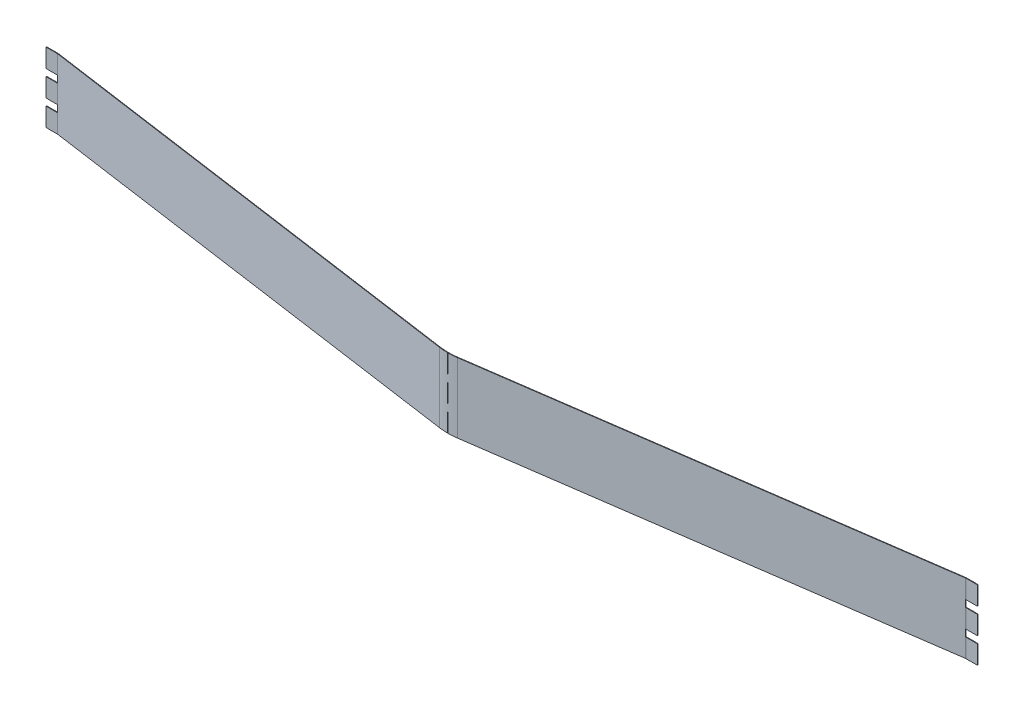
from build123d import *

# Parameters (mm, degrees)
BASE_FLANGE1_DEPTH  = 50
UNFOLD1_START       = -50
UNFOLD1_DEPTH       = 50
UNFOLD1_2_OUTLINE_W = 3.874357202
UNFOLD1_2_OUTLINE_H = 0.25
UNFOLD1_2_DEPTH     = 50
CUT_EXTRUDE2_DEPTH  = 211.401854511
SKETCH6_W           = 5.069534468
SKETCH6_H           = 3
CUT_EXTRUDE3_DEPTH  = 211.401854511
LPATTERN2_COUNT     = 2
LPATTERN2_PITCH     = 11
SKETCH8_W           = 0.3
SKETCH8_H           = 8
CUT_EXTRUDE4_DEPTH  = 211.401854511
LPATTERN3_COUNT     = 5
LPATTERN3_PITCH     = 11
SKETCH9_W           = 404.874357202
SKETCH9_H           = 46.767764052
CUT_EXTRUDE5_DEPTH  = 211.398245103
FOLD1_START         = -30
FOLD1_OUTLINE_W     = 3.874357202
FOLD1_OUTLINE_H     = 0.25
FOLD1_DEPTH         = 30
FOLD1_START_2       = -22
FOLD1_2_DEPTH       = 3
FOLD1_START_3       = -11
FOLD1_3_DEPTH       = 3
FOLD1_4_DEPTH       = 30
FOLD1_5_DEPTH       = 3
FOLD1_6_DEPTH       = 3
FOLD1_7_DEPTH       = 8
FOLD1_START_4       = -19
FOLD1_8_DEPTH       = 8
FOLD1_START_5       = -8
FOLD1_9_DEPTH       = 8


# Read off the part's stored shape, not the designer's step: Unfold1, Fold1
# Sheet-metal steps are written as plain solids
with BuildPart() as part:
    # Sketch1 → Base-Flange1 (new body)
    with BuildSketch(Plane(origin=(0, 0, 0), x_dir=(1, 0, 0), z_dir=(0, 1, 0))):
        with BuildLine():
            Line((-200.5, 0), (-195.552065744, 0))
            ThreePointArc((-195.552065744, 0), (-195.50012958, -0.001833238), (-195.448451933, -0.007323826))
            Line((-195.448451933, -0.007323826), (-3.868286445, -27.226574518))
            ThreePointArc((-3.868286445, -27.226574518), (0, -27.5), (3.868286445, -27.226574518))
            Line((3.868286445, -27.226574518), (195.448451933, -0.007323826))
            ThreePointArc((195.448451933, -0.007323826), (195.50012958, -0.001833238), (195.552065744, 0))
            Line((195.552065744, 0), (200.5, 0))
            Line((200.5, 0), (200.5, 0.25))
            Line((200.5, 0.25), (195.552065744, 0.25))
            ThreePointArc((195.552065744, 0.25), (195.48250259, 0.247544566), (195.413285693, 0.240190488))
            Line((195.413285692, 0.240190488), (3.833120205, -26.979060204))
            ThreePointArc((3.833120205, -26.979060204), (0, -27.25), (-3.833120205, -26.979060204))
            Line((-3.833120205, -26.979060204), (-195.413285692, 0.240190488))
            ThreePointArc((-195.413285692, 0.240190488), (-195.48250259, 0.247544566), (-195.552065743, 0.25))
            Line((-195.552065744, 0.25), (-200.5, 0.25))
            Line((-200.5, 0.25), (-200.5, 0))
        make_face()
    extrude(amount=-BASE_FLANGE1_DEPTH)

    # Unfold1 outline → Unfold1 (cut)
    with BuildSketch(Plane(origin=(0, 0, 0), x_dir=(1, 0, 0), z_dir=(0, 1, 0)).offset(UNFOLD1_START)):
        with BuildLine():
            Line((195.552065744, 0), (193.722727272, 0))
            Line((193.722727272, 0), (3.833120205, -26.979060204))
            ThreePointArc((3.833120205, -26.979060204), (0, -27.25), (-3.833120205, -26.979060204))
            Line((-3.833120205, -26.979060204), (-193.722727272, 0))
            Line((-193.722727272, 0), (-195.552065744, 0))
            ThreePointArc((-195.552065744, 0), (-195.500129581, -0.001833238), (-195.448451933, -0.007323826))
            Line((-195.448451933, -0.007323826), (-3.868286445, -27.226574518))
            ThreePointArc((-3.868286445, -27.226574518), (0, -27.5), (3.868286445, -27.226574518))
            Line((3.868286445, -27.226574518), (195.448451933, -0.007323826))
            ThreePointArc((195.448451933, -0.007323826), (195.500129581, -0.001833238), (195.552065744, 0))
        make_face()
    extrude(amount=UNFOLD1_DEPTH, mode=Mode.SUBTRACT)

    # Unfold1 2 outline → Unfold1 2 (add)
    with BuildSketch(Plane(origin=(0, 0, 0), x_dir=(1, 0, 0), z_dir=(0, 1, 0)).offset(UNFOLD1_START)):
        with BuildLine():
            ThreePointArc((195.413285692, 0.240190488), (195.48250259, 0.247544566), (195.552065744, 0.25))
            Line((195.552065744, 0.25), (-195.552065744, 0.25))
            ThreePointArc((-195.552065744, 0.25), (-195.48250259, 0.247544566), (-195.413285692, 0.240190488))
            Line((-195.413285692, 0.240190488), (-193.722727272, 0))
            Line((-193.722727272, 0), (193.722727272, 0))
            Line((193.722727272, 0), (195.413285692, 0.240190488))
        make_face()
        with Locations((202.437178601, 0.125)):
            Rectangle(UNFOLD1_2_OUTLINE_W, UNFOLD1_2_OUTLINE_H)
    extrude(amount=UNFOLD1_2_DEPTH)

    # Sketch7 → Cut-Extrude2 (cut, through all)
    with BuildSketch(Plane.XY):
        Polygon((-200.5, -30), (-195.552065744, -30), (1.937178601, -50), (199.304822734, -30), (204.374357202, -30), (227.072555567, -34.066984848), (175.364463115, -76.287353915), (-151.111703925, -76.287353915), (-215.740676819, -64.707357595), align=None)
    extrude(amount=-CUT_EXTRUDE2_DEPTH, mode=Mode.SUBTRACT)

    # Sketch6 → Cut-Extrude3 (cut, through all)
    with BuildSketch(Plane.XY):
        with Locations((-197.965232766, -9.5)):
            Rectangle(SKETCH6_W, SKETCH6_H)
        with Locations((201.839589968, -9.5)):
            Rectangle(SKETCH6_W, SKETCH6_H)
    cut_extrude3 = extrude(amount=-CUT_EXTRUDE3_DEPTH, mode=Mode.SUBTRACT)

    # LPattern2: Cut-Extrude3 ×2
    with Locations(*[(0, -i * LPATTERN2_PITCH, 0) for i in range(1, LPATTERN2_COUNT)]):
        add(cut_extrude3, mode=Mode.SUBTRACT)

    # Sketch8 → Cut-Extrude4 (cut, through all)
    with BuildSketch(Plane.XY):
        with Locations((1.937178601, -4)):
            Rectangle(SKETCH8_W, SKETCH8_H)
    cut_extrude4 = extrude(amount=-CUT_EXTRUDE4_DEPTH, mode=Mode.SUBTRACT)

    # LPattern3: Cut-Extrude4 ×5
    with Locations(*[(0, -i * LPATTERN3_PITCH, 0) for i in range(1, LPATTERN3_COUNT)]):
        add(cut_extrude4, mode=Mode.SUBTRACT)

    # Sketch9 → Cut-Extrude5 (cut, through all)
    with BuildSketch(Plane.XY):
        with Locations((1.937178601, -53.383882026)):
            Rectangle(SKETCH9_W, SKETCH9_H)
    extrude(amount=-CUT_EXTRUDE5_DEPTH, mode=Mode.SUBTRACT)

    # Fold1 outline → Fold1 (cut)
    with BuildSketch(Plane(origin=(0, 0, 0), x_dir=(1, 0, 0), z_dir=(0, 1, 0)).offset(FOLD1_START)):
        with BuildLine():
            Line((193.722727272, 0), (195.413285692, 0.240190488))
            ThreePointArc((195.413285692, 0.240190488), (195.48250259, 0.247544566), (195.552065744, 0.25))
            Line((195.552065744, 0.25), (-195.552065744, 0.25))
            ThreePointArc((-195.552065744, 0.25), (-195.48250259, 0.247544566), (-195.413285692, 0.240190488))
            Line((-195.413285692, 0.240190488), (-193.722727272, 0))
            Line((-193.722727272, 0), (193.722727272, 0))
        make_face()
        with Locations((202.437178601, 0.125)):
            Rectangle(FOLD1_OUTLINE_W, FOLD1_OUTLINE_H)
    extrude(amount=FOLD1_DEPTH, mode=Mode.SUBTRACT)

    # Fold1 2 outline → Fold1 2 (cut)
    with BuildSketch(Plane(origin=(0, 0, 0), x_dir=(1, 0, 0), z_dir=(0, 1, 0)).offset(FOLD1_START_2)):
        with BuildLine():
            ThreePointArc((195.552065744, 0.25), (195.48250259, 0.247544566), (195.413285692, 0.240190488))
            Line((195.413285692, 0.240190488), (195.447411381, 0))
            Line((195.447411381, 0), (199.304822734, 0))
            Line((199.304822734, 0), (199.304822734, 0.25))
            Line((199.304822734, 0.25), (195.552065744, 0.25))
        make_face()
        with BuildLine():
            Line((-195.430465532, 0.119271783), (-195.413285692, 0.240190488))
            ThreePointArc((-195.413285692, 0.240190488), (-195.42187059, 0.241371769), (-195.430465532, 0.242477601))
            Line((-195.430465532, 0.242477601), (-195.430465532, 0.119271783))
        make_face()
    extrude(amount=FOLD1_2_DEPTH, mode=Mode.SUBTRACT)

    # Fold1 3 outline → Fold1 3 (cut)
    with BuildSketch(Plane(origin=(0, 0, 0), x_dir=(1, 0, 0), z_dir=(0, 1, 0)).offset(FOLD1_START_3)):
        with BuildLine():
            ThreePointArc((195.552065744, 0.25), (195.48250259, 0.247544566), (195.413285692, 0.240190488))
            Line((195.413285692, 0.240190488), (195.447411381, 0))
            Line((195.447411381, 0), (199.304822734, 0))
            Line((199.304822734, 0), (199.304822734, 0.25))
            Line((199.304822734, 0.25), (195.552065744, 0.25))
        make_face()
        with BuildLine():
            Line((-195.430465532, 0.119271783), (-195.413285692, 0.240190488))
            ThreePointArc((-195.413285692, 0.240190488), (-195.42187059, 0.241371769), (-195.430465532, 0.242477601))
            Line((-195.430465532, 0.242477601), (-195.430465532, 0.119271783))
        make_face()
    extrude(amount=FOLD1_3_DEPTH, mode=Mode.SUBTRACT)

    # Fold1 4 outline → Fold1 4 (add)
    with BuildSketch(Plane(origin=(0, 0, 0), x_dir=(1, 0, 0), z_dir=(0, 1, 0)).offset(FOLD1_START)):
        with BuildLine():
            Line((195.447411381, 0), (193.722727272, 0))
            Line((193.722727272, 0), (3.833120205, -26.979060204))
            ThreePointArc((3.833120205, -26.979060204), (1.99580633, -27.176814697), (0.149314321, -27.249590919))
            Line((0.149314321, -27.249590919), (0.150684177, -27.499587166))
            ThreePointArc((0.150684177, -27.499587166), (2.014116479, -27.426143273), (3.868286445, -27.226574518))
            Line((3.868286445, -27.226574518), (195.448451933, -0.007323826))
            Line((195.448451933, -0.007323826), (195.447411381, 0))
        make_face()
        with BuildLine():
            Line((-0.150684177, -27.499587166), (-0.149314321, -27.249590919))
            ThreePointArc((-0.149314321, -27.249590919), (-1.99580633, -27.176814697), (-3.833120205, -26.979060204))
            Line((-3.833120205, -26.979060204), (-193.722727272, 0))
            Line((-193.722727272, 0), (-195.430465532, 0))
            Line((-195.430465532, 0), (-195.430465532, 0.119271783))
            Line((-195.430465532, 0.119271783), (-195.448451933, -0.007323826))
            Line((-195.448451933, -0.007323826), (-3.868286445, -27.226574518))
            ThreePointArc((-3.868286445, -27.226574518), (-2.014116479, -27.426143273), (-0.150684177, -27.499587166))
        make_face()
    extrude(amount=FOLD1_4_DEPTH)

    # Fold1 5 outline → Fold1 5 (add)
    with BuildSketch(Plane(origin=(0, 0, 0), x_dir=(1, 0, 0), z_dir=(0, 1, 0)).offset(FOLD1_START_2)):
        with BuildLine():
            Line((0.150684177, -27.499587166), (0.149314321, -27.249590919))
            ThreePointArc((0.149314321, -27.249590919), (0, -27.25), (-0.149314321, -27.249590919))
            Line((-0.149314321, -27.249590919), (-0.150684177, -27.499587166))
            ThreePointArc((-0.150684177, -27.499587166), (0, -27.5), (0.150684177, -27.499587166))
        make_face()
    extrude(amount=FOLD1_5_DEPTH)

    # Fold1 6 outline → Fold1 6 (add)
    with BuildSketch(Plane(origin=(0, 0, 0), x_dir=(1, 0, 0), z_dir=(0, 1, 0)).offset(FOLD1_START_3)):
        with BuildLine():
            Line((0.150684177, -27.499587166), (0.149314321, -27.249590919))
            ThreePointArc((0.149314321, -27.249590919), (0, -27.25), (-0.149314321, -27.249590919))
            Line((-0.149314321, -27.249590919), (-0.150684177, -27.499587166))
            ThreePointArc((-0.150684177, -27.499587166), (0, -27.5), (0.150684177, -27.499587166))
        make_face()
    extrude(amount=FOLD1_6_DEPTH)

    # Fold1 7 outline → Fold1 7 (add)
    with BuildSketch(Plane(origin=(0, 0, 0), x_dir=(1, 0, 0), z_dir=(0, 1, 0)).offset(FOLD1_START)):
        with BuildLine():
            Line((195.552065744, 0), (195.447411381, 0))
            Line((195.447411381, 0), (195.448451933, -0.007323826))
            ThreePointArc((195.448451933, -0.007323826), (195.500129581, -0.001833238), (195.552065744, 0))
        make_face()
        with BuildLine():
            ThreePointArc((-195.552065744, 0), (-195.500129581, -0.001833238), (-195.448451933, -0.007323826))
            Line((-195.448451933, -0.007323826), (-195.447411381, 0))
            Line((-195.447411381, 0), (-195.552065744, 0))
        make_face()
    extrude(amount=FOLD1_7_DEPTH)

    # Fold1 8 outline → Fold1 8 (add)
    with BuildSketch(Plane(origin=(0, 0, 0), x_dir=(1, 0, 0), z_dir=(0, 1, 0)).offset(FOLD1_START_4)):
        with BuildLine():
            Line((195.552065744, 0), (195.447411381, 0))
            Line((195.447411381, 0), (195.448451933, -0.007323826))
            ThreePointArc((195.448451933, -0.007323826), (195.500129581, -0.001833238), (195.552065744, 0))
        make_face()
        with BuildLine():
            ThreePointArc((-195.552065744, 0), (-195.500129581, -0.001833238), (-195.448451933, -0.007323826))
            Line((-195.448451933, -0.007323826), (-195.447411381, 0))
            Line((-195.447411381, 0), (-195.552065744, 0))
        make_face()
    extrude(amount=FOLD1_8_DEPTH)

    # Fold1 9 outline → Fold1 9 (add)
    with BuildSketch(Plane(origin=(0, 0, 0), x_dir=(1, 0, 0), z_dir=(0, 1, 0)).offset(FOLD1_START_5)):
        with BuildLine():
            Line((195.552065744, 0), (195.447411381, 0))
            Line((195.447411381, 0), (195.448451933, -0.007323826))
            ThreePointArc((195.448451933, -0.007323826), (195.500129581, -0.001833238), (195.552065744, 0))
        make_face()
        with BuildLine():
            ThreePointArc((-195.552065744, 0), (-195.500129581, -0.001833238), (-195.448451933, -0.007323826))
            Line((-195.448451933, -0.007323826), (-195.447411381, 0))
            Line((-195.447411381, 0), (-195.552065744, 0))
        make_face()
    extrude(amount=FOLD1_9_DEPTH)


solid = part.part
